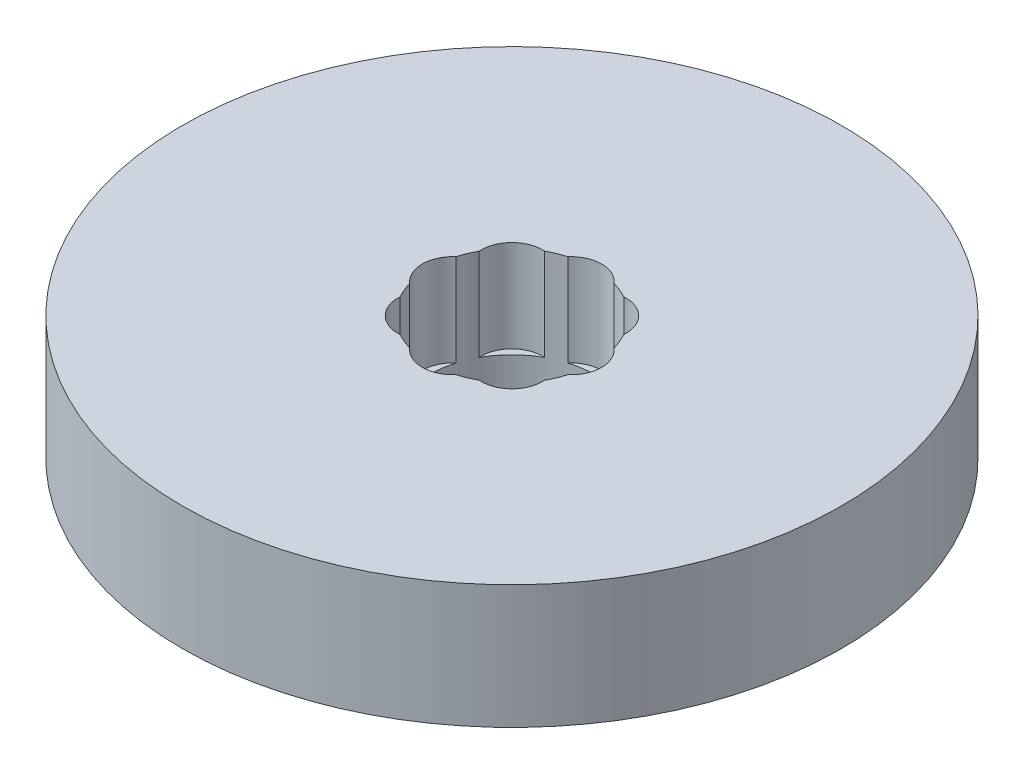
from build123d import *

# Parameters (mm, degrees)
SKETCH1_R           = 80
BOSS_EXTRUDE1_DEPTH = 30
SKETCH2_R           = 20
CUT_EXTRUDE1_DEPTH  = 118.046999107
SKETCH3_R           = 7.440638603
CUT_EXTRUDE2_DEPTH  = 22.345053117
CIRPATTERN1_COUNT   = 8


with BuildPart() as part:
    # Sketch1 → Boss-Extrude1 (new body)
    with BuildSketch(Plane(origin=(0, 0, 0), x_dir=(1, 0, 0), z_dir=(0, 1, 0))):
        Circle(SKETCH1_R)
    extrude(amount=BOSS_EXTRUDE1_DEPTH)

    # Sketch2 → Cut-Extrude1 (cut, through all)
    with BuildSketch(Plane(origin=(0, 0, 0), x_dir=(1, 0, 0), z_dir=(0, 1, 0))):
        Circle(SKETCH2_R)
    extrude(amount=CUT_EXTRUDE1_DEPTH, mode=Mode.SUBTRACT)

    # Sketch3 → Cut-Extrude2 (cut)
    with BuildSketch(Plane(origin=(0, 30, 0), x_dir=(1, 0, 0), z_dir=(0, 1, 0))):
        with Locations((-14.311133997, 0)):
            Circle(SKETCH3_R)
    cut_extrude2 = extrude(amount=-CUT_EXTRUDE2_DEPTH, mode=Mode.SUBTRACT)

    # CirPattern1: Cut-Extrude2 ×8 about axis
    cirpattern1_axis = Axis((0, 0, 0), (0, 1, 0))
    for i in range(1, CIRPATTERN1_COUNT):
        add(cut_extrude2.rotate(cirpattern1_axis, i * 360 / CIRPATTERN1_COUNT), mode=Mode.SUBTRACT)


solid = part.part
